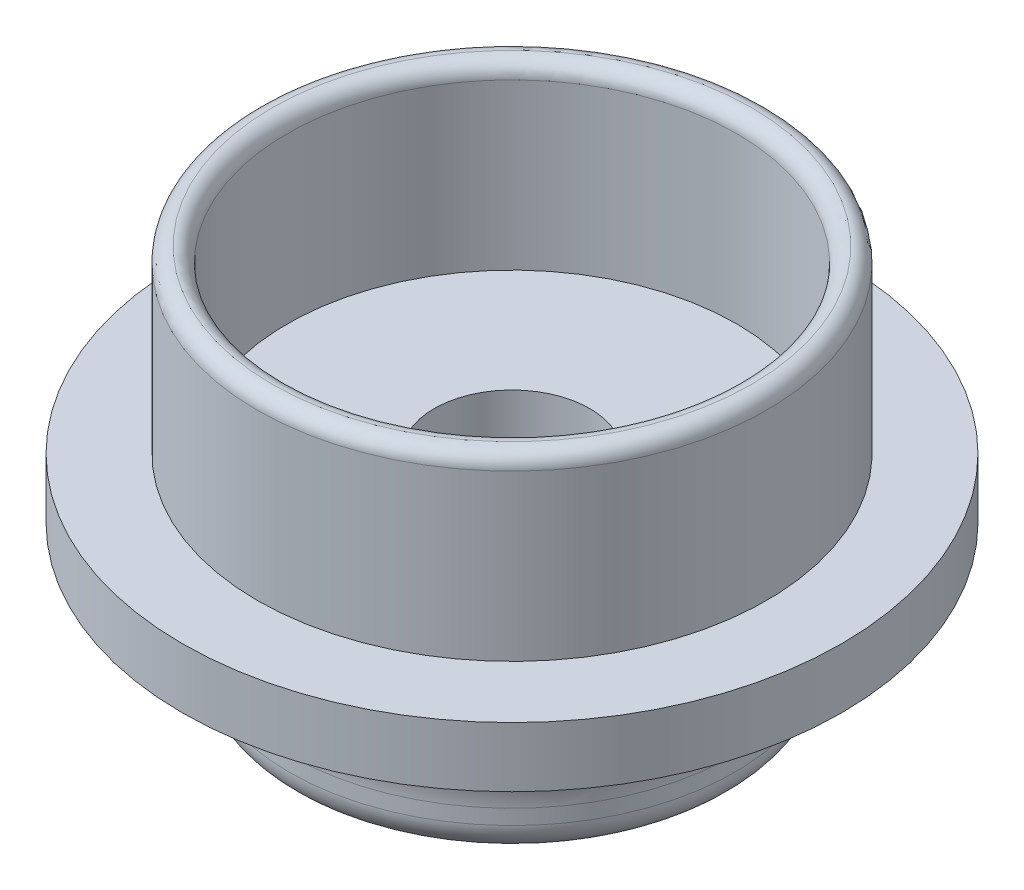
from build123d import *

# Parameters (mm, degrees)
SKETCH1_R           = 11
BOSS_EXTRUDE1_DEPTH = 2
SKETCH2_R           = 8.5
SKETCH2_R_2         = 7.5
BOSS_EXTRUDE2_DEPTH = 6
SKETCH3_R           = 2.6
CUT_EXTRUDE1_DEPTH  = 17.673332001
SKETCH4_R           = 7.43362206
BOSS_EXTRUDE3_DEPTH = 4.5
FILLET1_R           = 3
FILLET2_R           = 1
FILLET3_R           = 0.5


with BuildPart() as part:
    # Sketch1 → Boss-Extrude1 (new body)
    with BuildSketch(Plane(origin=(0, 0, 0), x_dir=(1, 0, 0), z_dir=(0, 1, 0))):
        with Locations(Location((0, 0, 0), (0, 0, 270))):
            Circle(SKETCH1_R)
    extrude(amount=BOSS_EXTRUDE1_DEPTH)

    # Sketch2 → Boss-Extrude2 (add)
    with BuildSketch(Plane(origin=(0, 2, 0), x_dir=(1, 0, 0), z_dir=(0, 1, 0))):
        with Locations(Location((0, 0, 0), (0, 0, 270))):
            Circle(SKETCH2_R)
        with Locations(Location((0, 0, 0), (0, 0, 270))):
            Circle(SKETCH2_R_2, mode=Mode.SUBTRACT)
    extrude(amount=BOSS_EXTRUDE2_DEPTH)

    # Sketch3 → Cut-Extrude1 (cut, through all)
    with BuildSketch(Plane(origin=(0, 2, 0), x_dir=(1, 0, 0), z_dir=(0, 1, 0))):
        with Locations(Location((0, 0, 0), (0, 0, 270))):
            Circle(SKETCH3_R)
    extrude(amount=-CUT_EXTRUDE1_DEPTH, mode=Mode.SUBTRACT)

    # Sketch4 → Boss-Extrude3 (add)
    with BuildSketch(Plane.XZ):
        with Locations(Location((0, 0, 0), (0, 0, 270))):
            Circle(SKETCH4_R)
        Polygon((0, -5.311622477), (4.6, -2.655811238), (4.6, 2.655811238), (0, 5.311622477), (-4.6, 2.655811238), (-4.6, -2.655811238), align=None, mode=Mode.SUBTRACT)
    extrude(amount=BOSS_EXTRUDE3_DEPTH)

    # Fillet1
    fillet1_edges = [part.edges().sort_by_distance(p)[0] for p in [
        (0, 0, 7.43362206),
    ]]
    fillet(fillet1_edges, radius=FILLET1_R)

    # Fillet2
    fillet2_edges = [part.edges().sort_by_distance(p)[0] for p in [
        (0, -4.5, 7.43362206),
    ]]
    fillet(fillet2_edges, radius=FILLET2_R)

    # Fillet3
    fillet3_edges = [part.edges().sort_by_distance(p)[0] for p in [
        (0, 8, -8.5),
        (0, 8, -7.5),
    ]]
    fillet(fillet3_edges, radius=FILLET3_R - 0.0001)  # a hair under: the kernel refuses the full size


solid = part.part
